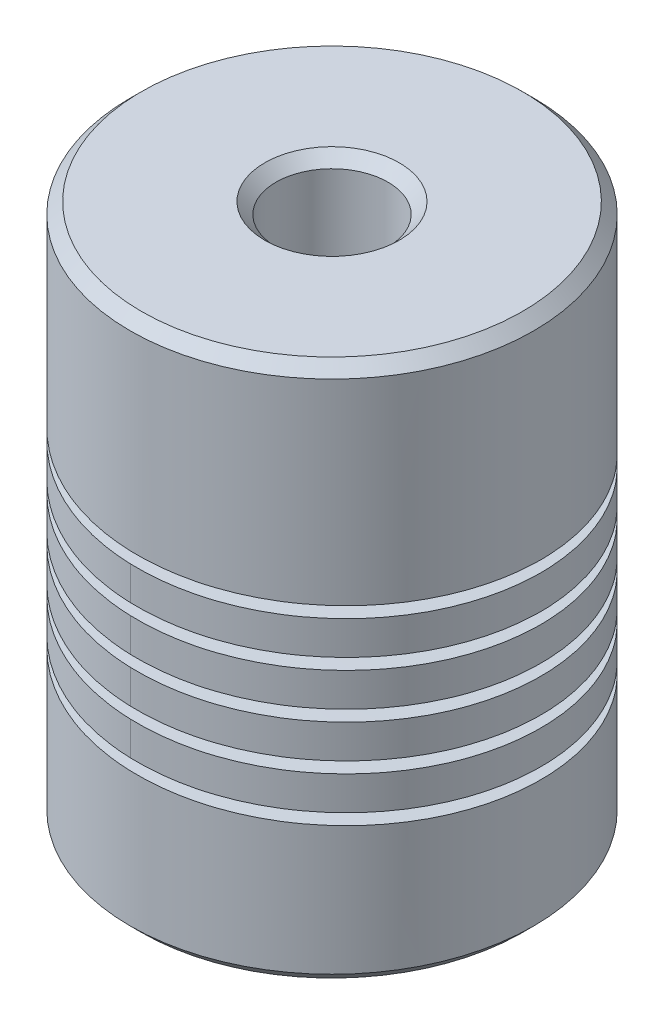
from build123d import *

# Parameters (mm, degrees)
SKETCH1_R           = 9
BOSS_EXTRUDE1_DEPTH = 24
SKETCH2_R           = 2.5
CUT_EXTRUDE1_DEPTH  = 28.166155414
SKETCH3_R           = 4
CUT_EXTRUDE2_DEPTH  = 16
CHAMFER1_SIZE       = 0.5
CUT_SWEEP2_PITCH    = 2


with BuildPart() as part:
    # Sketch1 → Boss-Extrude1 (new body)
    with BuildSketch(Plane(origin=(0, 0, 0), x_dir=(1, 0, 0), z_dir=(0, 1, 0))):
        with Locations(Location((0, 0, 0), (0, 0, 270))):
            Circle(SKETCH1_R)
    extrude(amount=BOSS_EXTRUDE1_DEPTH)

    # Sketch2 → Cut-Extrude1 (cut, through all)
    with BuildSketch(Plane(origin=(0, 24, 0), x_dir=(1, 0, 0), z_dir=(0, 1, 0))):
        with Locations(Location((0, 0, 0), (0, 0, 270))):
            Circle(SKETCH2_R)
    extrude(amount=-CUT_EXTRUDE1_DEPTH, mode=Mode.SUBTRACT)

    # Sketch3 → Cut-Extrude2 (cut)
    with BuildSketch(Plane.XZ):
        with Locations(Location((0, 0, 0), (0, 0, 270))):
            Circle(SKETCH3_R)
    extrude(amount=-CUT_EXTRUDE2_DEPTH, mode=Mode.SUBTRACT)

    # Chamfer1
    chamfer1_edges = [part.edges().sort_by_distance(p)[0] for p in [
        (0, 0, 4),
        (0, 0, -9),
        (0, 24, -9),
        (0, 24, -2.5),
    ]]
    chamfer(chamfer1_edges, length=CHAMFER1_SIZE)

    # Cut-Sweep2: the profile of Sketch8 profile screwed along a left-hand helix of 5 turns, 10 arcs to a turn; built about Z, then put on its axis
    cut_sweep2_z = Axis((0, 0, 0), (0, 0, 1))
    cut_sweep2_corners = [(9, 0, 0), (3.9997, 0, 0), (3.9997, 0, 0.5), (9, 0, 0.5)]
    with BuildLine(mode=Mode.PRIVATE) as cut_sweep2_profile:
        Line(cut_sweep2_corners[0], cut_sweep2_corners[1])
        Line(cut_sweep2_corners[1], cut_sweep2_corners[2])
        Line(cut_sweep2_corners[2], cut_sweep2_corners[3])
        Line(cut_sweep2_corners[3], cut_sweep2_corners[0])
    cut_sweep2_cap = Face(cut_sweep2_profile.wire())
    cut_sweep2_turn_angles = [0, -18, -36, -54, -72, -90, -108, -126, -144, -162, -180, -198, -216, -234, -252, -270, -288, -306, -324, -342, -360]
    cut_sweep2_turn_weights = [1, 0.9510565162951535, 1, 0.9510565162951535, 1, 0.9510565162951535, 1, 0.9510565162951535, 1, 0.9510565162951535, 1, 0.9510565162951535, 1, 0.9510565162951535, 1, 0.9510565162951535, 1, 0.9510565162951535, 1, 0.9510565162951535, 1]
    cut_sweep2_turn_rails = [Edge.make_bspline([Vector(p[0], p[1], 0).rotate(cut_sweep2_z, cut_sweep2_turn_angles[k]) / cut_sweep2_turn_weights[k] + Vector(0, 0, p[2] + -CUT_SWEEP2_PITCH * cut_sweep2_turn_angles[k] / 360) for k in range(21)], [0, 0, 0, 1, 1, 2, 2, 3, 3, 4, 4, 5, 5, 6, 6, 7, 7, 8, 8, 9, 9, 10, 10, 10], 2, cut_sweep2_turn_weights) for p in cut_sweep2_corners]
    cut_sweep2_turn_sides = [Face.make_surface_from_curves(cut_sweep2_turn_rails[p[0]], cut_sweep2_turn_rails[p[1]]) for p in [(0, 1), (1, 2), (2, 3), (3, 0)]]
    cut_sweep2 = Plane(origin=(0, 16, 0), x_dir=(0, 0, -1), z_dir=(0, -1, 0)) * Solid(Shell([*[p.moved(Location((0, 0, CUT_SWEEP2_PITCH * i))) for i in range(5) for p in cut_sweep2_turn_sides], cut_sweep2_cap, cut_sweep2_cap.rotate(cut_sweep2_z, -1800).moved(Location((0, 0, -CUT_SWEEP2_PITCH * -1800 / 360)))]))
    add(cut_sweep2, mode=Mode.SUBTRACT)


solid = part.part
